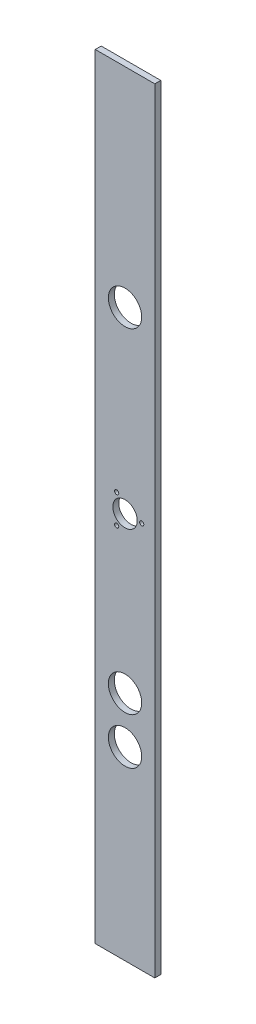
from build123d import *

# Parameters (mm, degrees)
ESQUISSE1_W        = 50
ESQUISSE1_H        = 650
ESQUISSE1_R        = 1.75
ESQUISSE1_R_2      = 10.25
ESQUISSE1_R_3      = 14
BOSS_EXTRU_1_DEPTH = 5
CHANFREIN1_SIZE    = 1


with BuildPart() as part:
    # Esquisse1 → Boss.-Extru.1 (new body)
    with BuildSketch(Plane.XY):
        with Locations((25, -325)):
            Rectangle(ESQUISSE1_W, ESQUISSE1_H)
        with Locations((18, -312.875644347)):
            Circle(ESQUISSE1_R, mode=Mode.SUBTRACT)
        with Locations((39, -325)):
            Circle(ESQUISSE1_R, mode=Mode.SUBTRACT)
        with Locations((25, -325)):
            Circle(ESQUISSE1_R_2, mode=Mode.SUBTRACT)
        with Locations((25, -494.5)):
            Circle(ESQUISSE1_R_3, mode=Mode.SUBTRACT)
        with Locations((25, -455.5)):
            Circle(ESQUISSE1_R_3, mode=Mode.SUBTRACT)
        with Locations((25, -175)):
            Circle(ESQUISSE1_R_3, mode=Mode.SUBTRACT)
        with Locations((18, -337.124355653)):
            Circle(ESQUISSE1_R, mode=Mode.SUBTRACT)
    extrude(amount=BOSS_EXTRU_1_DEPTH)

    # Chanfrein1
    chanfrein1_edges = [part.edges().sort_by_distance(p)[0] for p in [
        (16.25, -337.124355653, 0),
        (16.25, -312.875644347, 0),
        (37.25, -325, 0),
    ]]
    chamfer(chanfrein1_edges, length=CHANFREIN1_SIZE)


solid = part.part
